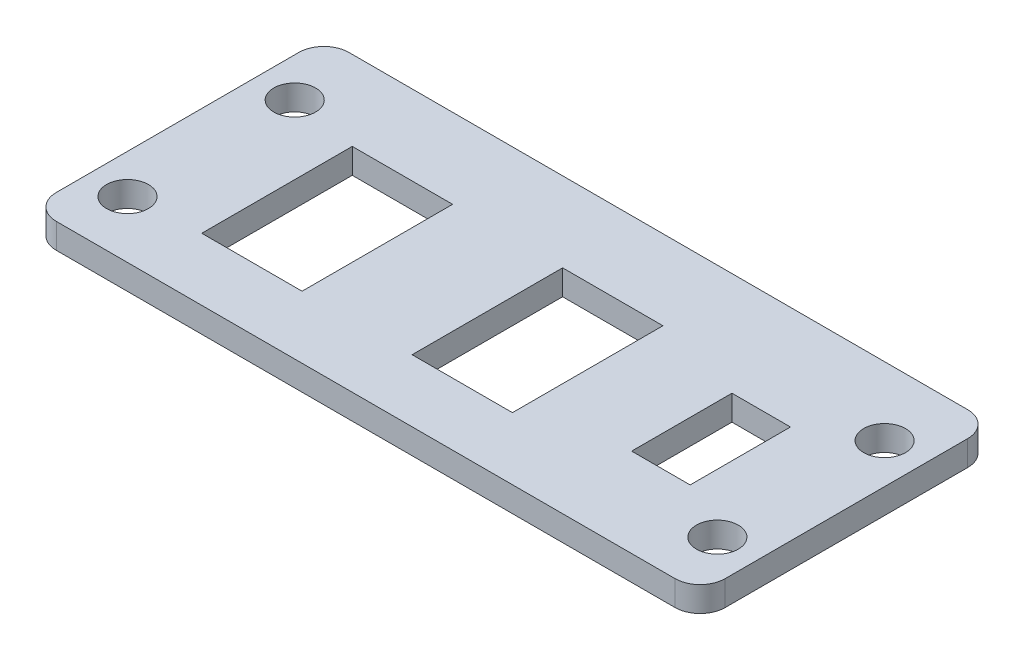
from build123d import *

# Parameters (mm, degrees)
SKETCH1_W           = 80
SKETCH1_H           = 35
SKETCH1_R           = 2.5
SKETCH1_W_2         = 12
SKETCH1_H_2         = 18
SKETCH1_W_3         = 7
SKETCH1_H_3         = 12
BOSS_EXTRUDE1_DEPTH = 3
FILLET1_R           = 3


with BuildPart() as part:
    # Sketch1 → Boss-Extrude1 (new body)
    with BuildSketch(Plane(origin=(0, 0, 0), x_dir=(1, 0, 0), z_dir=(0, 1, 0))):
        with Locations((311.134650114, -80.595715333)):
            Rectangle(SKETCH1_W, SKETCH1_H)
        with Locations((275.818253153, -71.268297863)):
            Circle(SKETCH1_R, mode=Mode.SUBTRACT)
        with Locations((275.818253153, -91.268297863)):
            Circle(SKETCH1_R, mode=Mode.SUBTRACT)
        with Locations((346.370521359, -71.268297863)):
            Circle(SKETCH1_R, mode=Mode.SUBTRACT)
        with Locations((346.370521359, -91.268297863)):
            Circle(SKETCH1_R, mode=Mode.SUBTRACT)
        with Locations((315.220523964, -81.629701497)):
            Rectangle(SKETCH1_W_2, SKETCH1_H_2, mode=Mode.SUBTRACT)
        with Locations((290.062529159, -81.629701497)):
            Rectangle(SKETCH1_W_2, SKETCH1_H_2, mode=Mode.SUBTRACT)
        with Locations((335.834815931, -81.489103707)):
            Rectangle(SKETCH1_W_3, SKETCH1_H_3, mode=Mode.SUBTRACT)
    extrude(amount=BOSS_EXTRUDE1_DEPTH)

    # Fillet1
    fillet1_edges = [part.edges().sort_by_distance(p)[0] for p in [
        (271.134650114, 1.5, 98.095715333),
        (271.134650114, 1.5, 63.095715333),
        (351.134650114, 1.5, 63.095715333),
        (351.134650114, 1.5, 98.095715333),
    ]]
    fillet(fillet1_edges, radius=FILLET1_R)


solid = part.part
